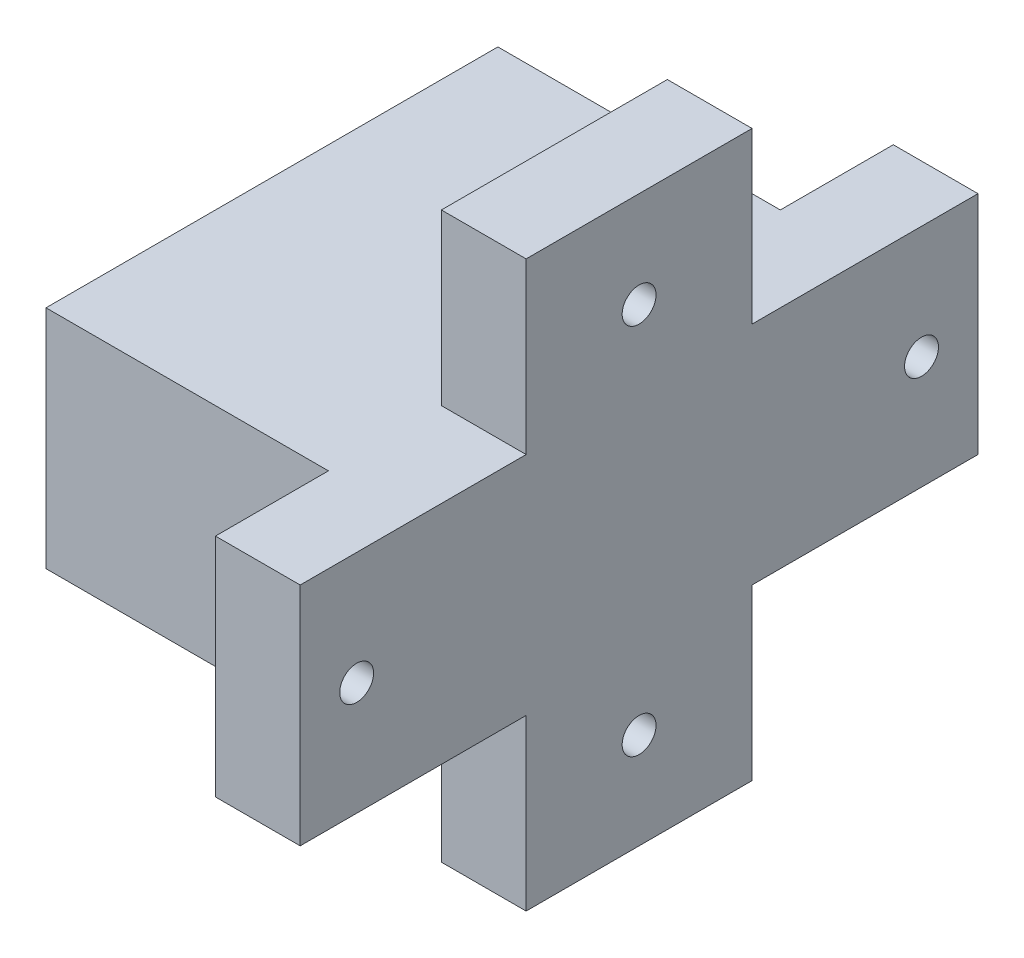
from build123d import *

# Parameters (mm, degrees)
STOCK_EXHAUST_M5_WASHER15_B_1_START         = 200
STOCK_EXHAUST_M5_WASHER15_B_1_OUTLINE_R     = 7.5
STOCK_EXHAUST_M5_WASHER15_B_1_DEPTH         = 15
STOCK_EXHAUST_M5_WASHER15_B_1_START_2       = 202
STOCK_EXHAUST_M5_WASHER15_B_1_2_OUTLINE_R   = 7.5
STOCK_EXHAUST_M5_WASHER15_B_1_2_OUTLINE_R_2 = 3
STOCK_EXHAUST_M5_WASHER15_B_1_2_DEPTH       = 13
SKETCH1_W                                   = 80
SKETCH1_H                                   = 40
BOSS_EXTRUDE1_DEPTH                         = 50
SKETCH2_W                                   = 21
SKETCH2_H                                   = 21
CUT_EXTRUDE1_DEPTH                          = 50
LPATTERN1_COUNT                             = 2
LPATTERN1_PITCH                             = 25
LPATTERN1_COL_COUNT                         = 2
LPATTERN1_COL_PITCH                         = 25


# Read off the part's stored shape, not the designer's step: Stock-Exhaust_M5_washer15_B-1
with BuildPart() as part:
    # Stock-Exhaust_M5_washer15_B-1 outline → Stock-Exhaust_M5_washer15_B-1 (new body)
    with BuildSketch(Plane.YZ.offset(STOCK_EXHAUST_M5_WASHER15_B_1_START)):
        Polygon((-40, -20), (-10, -20), (-10, -60), (30, -60), (30, -20), (60, -20), (60, 20), (30, 20), (30, 60), (-10, 60), (-10, 20), (-40, 20), align=None)
        with Locations((10, -50)):
            Circle(STOCK_EXHAUST_M5_WASHER15_B_1_OUTLINE_R, mode=Mode.SUBTRACT)
        with Locations((-23, 0)):
            Circle(STOCK_EXHAUST_M5_WASHER15_B_1_OUTLINE_R, mode=Mode.SUBTRACT)
        with Locations((43, 0)):
            Circle(STOCK_EXHAUST_M5_WASHER15_B_1_OUTLINE_R, mode=Mode.SUBTRACT)
        with Locations((10, 50)):
            Circle(STOCK_EXHAUST_M5_WASHER15_B_1_OUTLINE_R, mode=Mode.SUBTRACT)
    extrude(amount=STOCK_EXHAUST_M5_WASHER15_B_1_DEPTH)

    # Stock-Exhaust_M5_washer15_B-1 2 outline → Stock-Exhaust_M5_washer15_B-1 2 (add)
    # profile 1 of 4: a face of its own
    with BuildSketch(Plane.YZ.offset(STOCK_EXHAUST_M5_WASHER15_B_1_START_2)):
        with Locations((43, 0)):
            Circle(STOCK_EXHAUST_M5_WASHER15_B_1_2_OUTLINE_R)
        with Locations((43, 0)):
            Circle(STOCK_EXHAUST_M5_WASHER15_B_1_2_OUTLINE_R_2, mode=Mode.SUBTRACT)
    # profile 2 of 4: a face of its own
    with BuildSketch(Plane.YZ.offset(STOCK_EXHAUST_M5_WASHER15_B_1_START_2)):
        with Locations((10, 50)):
            Circle(STOCK_EXHAUST_M5_WASHER15_B_1_2_OUTLINE_R)
        with Locations((10, 50)):
            Circle(STOCK_EXHAUST_M5_WASHER15_B_1_2_OUTLINE_R_2, mode=Mode.SUBTRACT)
    # profile 3 of 4: a face of its own
    with BuildSketch(Plane.YZ.offset(STOCK_EXHAUST_M5_WASHER15_B_1_START_2)):
        with Locations((10, -50)):
            Circle(STOCK_EXHAUST_M5_WASHER15_B_1_2_OUTLINE_R)
        with Locations((10, -50)):
            Circle(STOCK_EXHAUST_M5_WASHER15_B_1_2_OUTLINE_R_2, mode=Mode.SUBTRACT)
    # profile 4 of 4: a face of its own
    with BuildSketch(Plane.YZ.offset(STOCK_EXHAUST_M5_WASHER15_B_1_START_2)):
        with Locations((-23, 0)):
            Circle(STOCK_EXHAUST_M5_WASHER15_B_1_2_OUTLINE_R)
        with Locations((-23, 0)):
            Circle(STOCK_EXHAUST_M5_WASHER15_B_1_2_OUTLINE_R_2, mode=Mode.SUBTRACT)
    extrude(amount=STOCK_EXHAUST_M5_WASHER15_B_1_2_DEPTH)

    # Sketch1 → Boss-Extrude1 (add)
    with BuildSketch(Plane.ZY.offset(-200)):
        with Locations((0, 10)):
            Rectangle(SKETCH1_W, SKETCH1_H)
    extrude(amount=BOSS_EXTRUDE1_DEPTH)

    # Sketch2 → Cut-Extrude1 (cut)
    with BuildSketch(Plane.ZY.offset(-150)):
        with Locations((0, 10)):
            Rectangle(SKETCH2_W, SKETCH2_H)
    cut_extrude1 = extrude(amount=-CUT_EXTRUDE1_DEPTH, mode=Mode.SUBTRACT)

    # LPattern1: Cut-Extrude1 ×2
    with Locations(*[(0, 0, i * LPATTERN1_PITCH) for i in range(1, LPATTERN1_COUNT)]):
        add(cut_extrude1, mode=Mode.SUBTRACT)

    # LPattern1 col: Cut-Extrude1 ×2
    with Locations(*[(0, 0, -i * LPATTERN1_COL_PITCH) for i in range(1, LPATTERN1_COL_COUNT)]):
        add(cut_extrude1, mode=Mode.SUBTRACT)


solid = part.part
